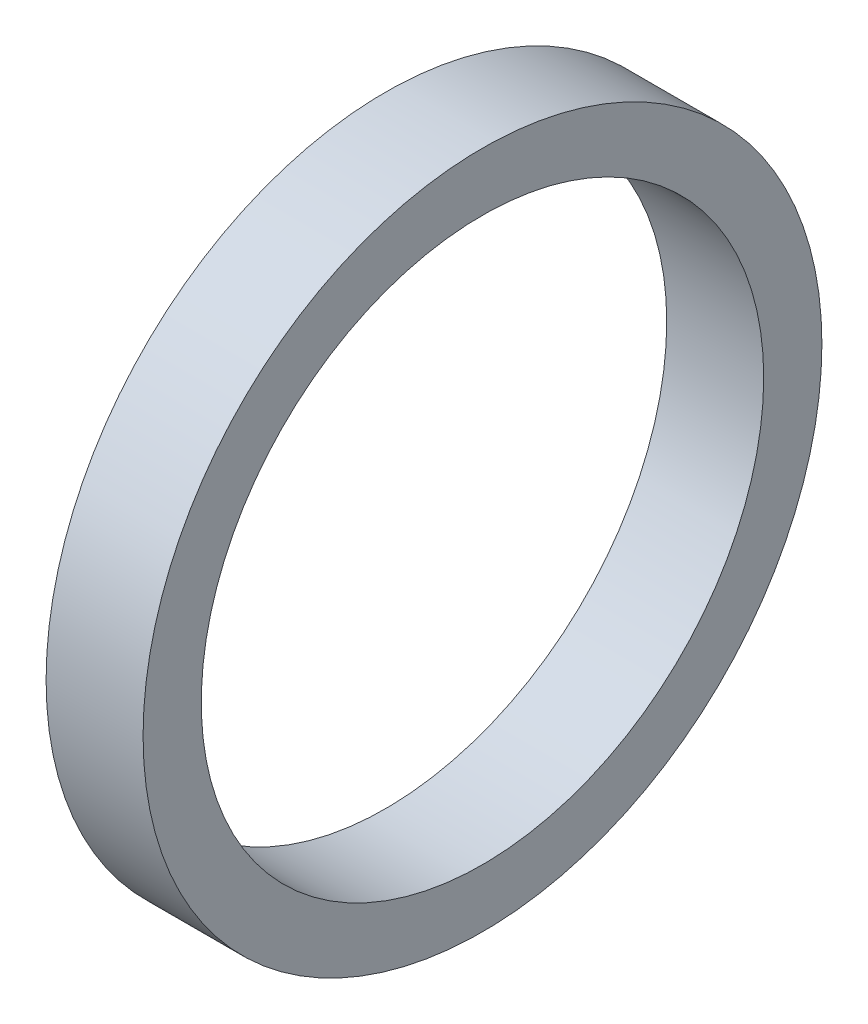
from build123d import *

# Parameters (mm, degrees)
SKETCH1_R           = 35
SKETCH1_R_2         = 29
BOSS_EXTRUDE1_DEPTH = 10


with BuildPart() as part:
    # Sketch1 → Boss-Extrude1 (new body)
    with BuildSketch(Plane(origin=(0, 0, 0), x_dir=(0, 0, -1), z_dir=(1, 0, 0))):
        Circle(SKETCH1_R)
        Circle(SKETCH1_R_2, mode=Mode.SUBTRACT)
    extrude(amount=BOSS_EXTRUDE1_DEPTH)


solid = part.part
